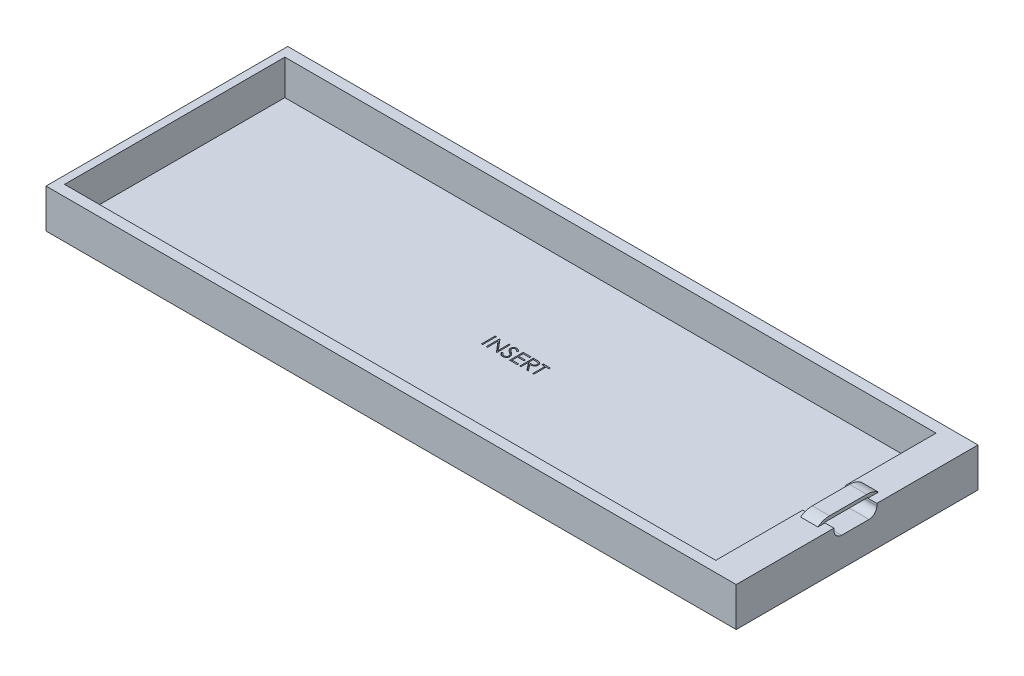
from build123d import *

# Parameters (mm, degrees)
SKETCH1_W           = 177
SKETCH1_H           = 62
BOSS_EXTRUDE1_DEPTH = 10
SKETCH2_W           = 167
SKETCH2_H           = 56.5
CUT_EXTRUDE2_DEPTH  = 9
SKETCH4_W           = 0.314102564
SKETCH4_H           = 3.5
CUT_EXTRUDE4_DEPTH  = 29
SKETCH5_W           = 4.425151698
SKETCH5_H           = 15.523308992
BOSS_EXTRUDE3_DEPTH = 1
SKETCH6_W           = 11
SKETCH6_H           = 2.75
CUT_EXTRUDE6_DEPTH  = 11
FILLET1_R           = 5
FILLET3_R           = 2


with BuildPart() as part:
    # Sketch1 → Boss-Extrude1 (new body)
    with BuildSketch(Plane(origin=(0, 0, 0), x_dir=(1, 0, 0), z_dir=(0, 1, 0))):
        Rectangle(SKETCH1_W, SKETCH1_H)
    extrude(amount=BOSS_EXTRUDE1_DEPTH)

    # Sketch2 → Cut-Extrude2 (cut)
    with BuildSketch(Plane(origin=(0, 10, 0), x_dir=(1, 0, 0), z_dir=(0, 1, 0))):
        with Locations((-3, 0)):
            Rectangle(SKETCH2_W, SKETCH2_H)
    extrude(amount=-CUT_EXTRUDE2_DEPTH, mode=Mode.SUBTRACT)

    # Sketch4 → Cut-Extrude4 (cut)
    # profile 1 of 6: a face of its own
    with BuildSketch(Plane(origin=(0, 1, 0), x_dir=(1, 0, 0), z_dir=(0, 1, 0))):
        with Locations((-6.451568608, 0.510197407)):
            Rectangle(SKETCH4_W, SKETCH4_H)
    # profile 2 of 6: a face of its own
    with BuildSketch(Plane(origin=(0, 1, 0), x_dir=(1, 0, 0), z_dir=(0, 1, 0))):
        Polygon((-5.397081429, -1.239802593), (-5.397081429, 2.260197407), (-5.33117598, 2.260197407), (-3.018876301, -0.494510125), (-3.018876301, 2.260197407), (-2.704773737, 2.260197407), (-2.704773737, -1.239802593), (-2.77628816, -1.239802593), (-5.082978865, 1.508594843), (-5.082978865, -1.239802593), align=None)
    # profile 3 of 6: a face of its own
    with BuildSketch(Plane(origin=(0, 1, 0), x_dir=(1, 0, 0), z_dir=(0, 1, 0))):
        with BuildLine():
            Line((-2.166312198, -0.564622305), (-1.870438801, -0.387238491))
            add(Edge.make_bspline(
                [(-1.870438801, -0.387238491), (-1.842920563, -0.433302876), (-1.790196683, -0.52156046), (-1.702245324, -0.6408185), (-1.611112412, -0.742180657), (-1.516123079, -0.825057264), (-1.417857131, -0.890306151), (-1.315673077, -0.936508383), (-1.209915266, -0.965324358), (-1.137941445, -0.968824445), (-1.102009313, -0.970571824)],
                knots=[0, 0, 0, 0, 1.272034388, 2.437168799, 3.508375237, 4.49857839, 5.41946034, 6.295179144, 7.148887113, 8, 8, 8, 8], degree=3))
            add(Edge.make_bspline(
                [(-1.102009313, -0.970571824), (-1.071322453, -0.969717152), (-1.01048568, -0.968022761), (-0.920923437, -0.951741959), (-0.833941635, -0.92672983), (-0.751332997, -0.890908899), (-0.674237382, -0.847570413), (-0.606630687, -0.795224236), (-0.548184574, -0.73661803), (-0.500375459, -0.671235375), (-0.463695424, -0.600918227), (-0.435503356, -0.528742275), (-0.419858282, -0.453573707), (-0.417501529, -0.402963244), (-0.416312198, -0.377422786)],
                knots=[0, 0, 0, 0, 1.095163259, 2.171163733, 3.241058638, 4.321873601, 5.38011039, 6.391990106, 7.366004449, 8.327778327, 9.272591725, 10.192022065, 11.087607919, 12, 12, 12, 12], degree=3))
            add(Edge.make_bspline(
                [(-0.416312198, -0.377422786), (-0.417786509, -0.348281936), (-0.420783567, -0.289042847), (-0.446115047, -0.201643194), (-0.485964294, -0.115150624), (-0.522726938, -0.061649358), (-0.541812999, -0.033873106)],
                knots=[0, 0, 0, 0, 0.938893495, 1.908633276, 2.914225137, 4, 4, 4, 4], degree=3))
            add(Edge.make_bspline(
                [(-0.541812999, -0.033873106), (-0.557483614, -0.013826283), (-0.590382108, 0.028259516), (-0.64693962, 0.090904751), (-0.713305735, 0.15552317), (-0.78720929, 0.224582227), (-0.871342379, 0.294870024), (-0.963069893, 0.369738302), (-1.064733752, 0.446339879), (-1.136033248, 0.497712445), (-1.172822615, 0.524219843)],
                knots=[0, 0, 0, 0, 0.722233717, 1.516239348, 2.393582979, 3.351407094, 4.387010283, 5.505090956, 6.712668013, 8, 8, 8, 8], degree=3))
            add(Edge.make_bspline(
                [(-1.172822615, 0.524219843), (-1.209646611, 0.55044843), (-1.280051288, 0.600595492), (-1.37850987, 0.675019776), (-1.466554333, 0.743063646), (-1.543793349, 0.805367658), (-1.610192946, 0.861940263), (-1.666276357, 0.912238202), (-1.710614914, 0.957621763), (-1.735270495, 0.987063105), (-1.746340243, 1.000281541)],
                knots=[0, 0, 0, 0, 1.452282411, 2.77665338, 3.964542531, 5.026858415, 5.96415736, 6.766646006, 7.446254459, 8, 8, 8, 8], degree=3))
            add(Edge.make_bspline(
                [(-1.746340243, 1.000281541), (-1.761812788, 1.020882578), (-1.792241625, 1.061397282), (-1.83240763, 1.12472214), (-1.866546793, 1.189545405), (-1.893309125, 1.25604127), (-1.915845344, 1.323276198), (-1.931003275, 1.392127444), (-1.940494672, 1.462286063), (-1.941466658, 1.509499563), (-1.941953224, 1.533134105)],
                knots=[0, 0, 0, 0, 1.068054152, 2.10047183, 3.106115577, 4.101338837, 5.06977816, 6.043150881, 7.020423561, 8, 8, 8, 8], degree=3))
            add(Edge.make_bspline(
                [(-1.941953224, 1.533134105), (-1.940648015, 1.57016388), (-1.938065495, 1.643431944), (-1.916224977, 1.750462774), (-1.881752084, 1.852649191), (-1.833457196, 1.948979525), (-1.771199843, 2.036945506), (-1.699153869, 2.117558993), (-1.613342382, 2.185327575), (-1.519189759, 2.244539634), (-1.416133387, 2.290885559), (-1.308142484, 2.325846539), (-1.195045412, 2.345655797), (-1.118442277, 2.348498561), (-1.079573416, 2.349940996)],
                knots=[0, 0, 0, 0, 1.005424448, 1.989358655, 2.955360095, 3.929531133, 4.905563448, 5.876582895, 6.856512386, 7.866279853, 8.892233794, 9.918561126, 10.94386622, 12, 12, 12, 12], degree=3))
            add(Edge.make_bspline(
                [(-1.079573416, 2.349940996), (-1.038329316, 2.348518445), (-0.956307964, 2.345689444), (-0.835658748, 2.321091912), (-0.719498032, 2.280391241), (-0.626054767, 2.234202583), (-0.552922006, 2.188071167), (-0.497149273, 2.146051343), (-0.440631822, 2.097676234), (-0.382913767, 2.042816988), (-0.324973108, 1.980970237), (-0.265949656, 1.912559548), (-0.205705387, 1.838002992), (-0.166949527, 1.784778491), (-0.147081429, 1.75749308)],
                knots=[0, 0, 0, 0, 1.286793592, 2.559021753, 3.825965368, 5.121522368, 5.803751409, 6.523245864, 7.299691795, 8.125521123, 9.008227632, 9.944561021, 10.946284179, 12, 12, 12, 12], degree=3))
            Line((-0.147081429, 1.75749308), (-0.431035756, 1.542248689))
            add(Edge.make_bspline(
                [(-0.431035756, 1.542248689), (-0.448181688, 1.564337379), (-0.481200745, 1.606875032), (-0.531330232, 1.666446348), (-0.57857888, 1.720862827), (-0.62512928, 1.768127956), (-0.668522911, 1.810830089), (-0.710639954, 1.847389846), (-0.750874305, 1.878165441), (-0.801591216, 1.911009001), (-0.865308934, 1.943565505), (-0.94529347, 1.971114583), (-1.028879745, 1.987669645), (-1.085809377, 1.989858532), (-1.114629506, 1.990966637)],
                knots=[0, 0, 0, 0, 1.181633172, 2.275549214, 3.290209073, 4.226197932, 5.078386478, 5.862611352, 6.581680152, 7.217281963, 8.414376989, 9.595101626, 10.782541182, 12, 12, 12, 12], degree=3))
            add(Edge.make_bspline(
                [(-1.114629506, 1.990966637), (-1.150786028, 1.989754937), (-1.220510476, 1.987418288), (-1.319500712, 1.961898303), (-1.408594637, 1.921716443), (-1.485147202, 1.865401465), (-1.548884179, 1.798680472), (-1.594989638, 1.721901617), (-1.622739802, 1.637119214), (-1.626126082, 1.577977558), (-1.62785066, 1.547857663)],
                knots=[0, 0, 0, 0, 1.14458467, 2.207223713, 3.21896685, 4.227309161, 5.202851033, 6.127160689, 7.046193047, 8, 8, 8, 8], degree=3))
            add(Edge.make_bspline(
                [(-1.62785066, 1.547857663), (-1.627457533, 1.529106185), (-1.626670637, 1.491572565), (-1.615695839, 1.436121143), (-1.60159651, 1.380809804), (-1.579253879, 1.325887221), (-1.548408575, 1.270392862), (-1.507903399, 1.213371124), (-1.456890087, 1.154319416), (-1.417813075, 1.115912042), (-1.397181589, 1.095634105)],
                knots=[0, 0, 0, 0, 0.858281714, 1.717966888, 2.583508476, 3.4729293, 4.427298488, 5.488583878, 6.674047936, 8, 8, 8, 8], degree=3))
            add(Edge.make_bspline(
                [(-1.397181589, 1.095634105), (-1.389520217, 1.08879708), (-1.37131855, 1.072553871), (-1.338042624, 1.045961591), (-1.294099826, 1.013158818), (-1.240637624, 0.972571502), (-1.176670263, 0.92549004), (-1.102190707, 0.872516428), (-1.018029174, 0.811930969), (-0.958307258, 0.769573428), (-0.926728865, 0.747176573)],
                knots=[0, 0, 0, 0, 0.420754252, 0.999615792, 1.744751191, 2.668019286, 3.750313428, 4.999500688, 6.413464383, 8, 8, 8, 8], degree=3))
            add(Edge.make_bspline(
                [(-0.926728865, 0.747176573), (-0.888742951, 0.719535214), (-0.815188495, 0.666011552), (-0.710530915, 0.585595872), (-0.615637107, 0.506948103), (-0.530173904, 0.430570496), (-0.453296995, 0.357042403), (-0.385859274, 0.285479223), (-0.327173594, 0.21639365), (-0.263994376, 0.127821075), (-0.199436556, 0.01903999), (-0.143995049, -0.114238248), (-0.109036701, -0.248034569), (-0.104465186, -0.337961405), (-0.102209634, -0.382330638)],
                knots=[0, 0, 0, 0, 1.163667725, 2.253281268, 3.268753668, 4.215851969, 5.092017293, 5.902905408, 6.650798638, 7.335211899, 8.59617414, 9.77448103, 10.901945474, 12, 12, 12, 12], degree=3))
            add(Edge.make_bspline(
                [(-0.102209634, -0.382330638), (-0.102866772, -0.413709003), (-0.104168287, -0.475856387), (-0.119129201, -0.567111464), (-0.141048866, -0.655742333), (-0.1740861, -0.740653446), (-0.214409258, -0.823398209), (-0.265575506, -0.901806109), (-0.324883191, -0.977612508), (-0.392916956, -1.048795999), (-0.467362858, -1.114142195), (-0.546046553, -1.172271256), (-0.629096826, -1.22073958), (-0.716063142, -1.260290422), (-0.806965479, -1.291223939), (-0.901773263, -1.313636808), (-1.000642774, -1.327392519), (-1.067843256, -1.328820281), (-1.102009313, -1.329546183)],
                knots=[0, 0, 0, 0, 0.983748083, 1.948392443, 2.894712957, 3.844097841, 4.80183111, 5.778335162, 6.776009319, 7.81870978, 8.863265674, 9.881300176, 10.883814829, 11.87499822, 12.874611388, 13.892143829, 14.928324115, 16, 16, 16, 16], degree=3))
            add(Edge.make_bspline(
                [(-1.102009313, -1.329546183), (-1.128444656, -1.329035002), (-1.180982417, -1.328019076), (-1.258691898, -1.319037796), (-1.334831488, -1.306330692), (-1.40844577, -1.286156622), (-1.480483181, -1.261679645), (-1.550630416, -1.231541312), (-1.61892147, -1.195424111), (-1.685739053, -1.154129086), (-1.750913227, -1.106071342), (-1.813832695, -1.050097845), (-1.876561881, -0.98775234), (-1.937249277, -0.917341777), (-1.997122421, -0.840003694), (-2.055000831, -0.755014511), (-2.112082548, -0.662837157), (-2.147898016, -0.597972071), (-2.166312198, -0.564622305)],
                knots=[0, 0, 0, 0, 0.915332311, 1.819136955, 2.706846663, 3.586547465, 4.459518054, 5.340707479, 6.227863349, 7.133153174, 8.059268498, 9.028702269, 10.047606654, 11.120612155, 12.245963614, 13.433783089, 14.680604001, 16, 16, 16, 16], degree=3))
        make_face()
    # profile 4 of 6: a face of its own
    with BuildSketch(Plane(origin=(0, 1, 0), x_dir=(1, 0, 0), z_dir=(0, 1, 0))):
        Polygon((0.615739084, 2.260197407), (2.590098058, 2.260197407), (2.590098058, 1.901223048), (0.929841648, 1.901223048), (0.929841648, 0.824299971), (2.590098058, 0.824299971), (2.590098058, 0.465325612), (0.929841648, 0.465325612), (0.929841648, -0.880828234), (2.590098058, -0.880828234), (2.590098058, -1.239802593), (0.615739084, -1.239802593), align=None)
    # profile 5 of 6: a face of its own
    with BuildSketch(Plane(origin=(0, 1, 0), x_dir=(1, 0, 0), z_dir=(0, 1, 0))):
        with BuildLine():
            Line((3.218303187, 2.260197407), (3.91872386, 2.260197407))
            add(Edge.make_bspline(
                [(3.91872386, 2.260197407), (3.965464988, 2.260041821), (4.055213133, 2.259743078), (4.183786403, 2.258077315), (4.3006135, 2.25330296), (4.405633339, 2.249194376), (4.498843994, 2.241702435), (4.580531285, 2.234541788), (4.650318982, 2.225168127), (4.692564834, 2.216462704), (4.71169261, 2.212521125)],
                knots=[0, 0, 0, 0, 1.410062039, 2.707475311, 3.878576406, 4.937260626, 5.877586885, 6.699081471, 7.410979367, 8, 8, 8, 8], degree=3))
            add(Edge.make_bspline(
                [(4.71169261, 2.212521125), (4.737299234, 2.206194359), (4.787966223, 2.193675796), (4.860916289, 2.167216195), (4.930430613, 2.13659657), (4.996220438, 2.10063285), (5.057956229, 2.05905807), (5.116274539, 2.012589948), (5.171440003, 1.961482742), (5.221221633, 1.9044479), (5.268160685, 1.844611391), (5.307749311, 1.779907634), (5.341875791, 1.712246106), (5.369046308, 1.640938689), (5.390924281, 1.566676917), (5.406350521, 1.48878812), (5.415601708, 1.407627145), (5.416543564, 1.352269236), (5.417021135, 1.32419981)],
                knots=[0, 0, 0, 0, 1.027469482, 2.033020251, 3.019912614, 3.986113645, 4.951240523, 5.91722682, 6.890402269, 7.87763091, 8.8651537, 9.85103654, 10.82876324, 11.815024772, 12.821070561, 13.842952187, 14.906261191, 16, 16, 16, 16], degree=3))
            add(Edge.make_bspline(
                [(5.417021135, 1.32419981), (5.415552137, 1.277564706), (5.412685741, 1.186567538), (5.385960638, 1.054506657), (5.342184118, 0.931317342), (5.281860829, 0.817154704), (5.205041353, 0.714244059), (5.112716562, 0.623853603), (5.004834951, 0.548213691), (4.904405635, 0.495760886), (4.815691435, 0.462167977), (4.742658122, 0.438531619), (4.662991145, 0.420269653), (4.57745381, 0.403909522), (4.485690155, 0.391557827), (4.387920115, 0.382511233), (4.284073964, 0.376857184), (4.212734894, 0.376015179), (4.176035558, 0.375582022)],
                knots=[0, 0, 0, 0, 1.260483769, 2.459530307, 3.627416485, 4.787058657, 5.939039949, 7.08810263, 8.267026773, 9.491475466, 10.141966685, 10.831826277, 11.566392101, 12.351337768, 13.187381173, 14.07005841, 15.007169909, 16, 16, 16, 16], degree=3))
            Line((4.176035558, 0.375582022), (5.46189293, -1.239802593))
            Line((5.46189293, -1.239802593), (5.073471456, -1.239802593))
            Line((5.073471456, -1.239802593), (3.787614084, 0.375582022))
            Line((3.787614084, 0.375582022), (3.532405751, 0.375582022))
            Line((3.532405751, 0.375582022), (3.532405751, -1.239802593))
            Line((3.532405751, -1.239802593), (3.218303187, -1.239802593))
            Line((3.218303187, -1.239802593), (3.218303187, 2.260197407))
        make_face()
        with BuildLine():
            Line((3.532405751, 1.901223048), (3.532405751, 0.734556381))
            Line((3.532405751, 0.734556381), (4.173231071, 0.729648528))
            add(Edge.make_bspline(
                [(4.173231071, 0.729648528), (4.20315111, 0.729635292), (4.261144667, 0.729609635), (4.345045332, 0.733603412), (4.423165444, 0.73814673), (4.495206196, 0.745096075), (4.561199771, 0.754052147), (4.621113184, 0.765255131), (4.675044236, 0.778307194), (4.737942775, 0.79850882), (4.808179306, 0.830514838), (4.884510766, 0.877080337), (4.949513104, 0.935649456), (5.004430966, 1.002622912), (5.048560397, 1.076259161), (5.079672452, 1.15567553), (5.099414894, 1.238867128), (5.10174344, 1.296045236), (5.102918571, 1.324900932)],
                knots=[0, 0, 0, 0, 1.146690395, 2.22261258, 3.21895312, 4.145990853, 4.996080663, 5.770904154, 6.481378293, 7.121626537, 8.300444488, 9.431385265, 10.535395872, 11.636531494, 12.74115979, 13.810798291, 14.895190096, 16, 16, 16, 16], degree=3))
            add(Edge.make_bspline(
                [(5.102918571, 1.324900932), (5.10171645, 1.353047506), (5.099334285, 1.408823745), (5.079885516, 1.490479655), (5.046996135, 1.567546605), (5.002673897, 1.63971109), (4.948674742, 1.705216826), (4.885356929, 1.761263979), (4.814451734, 1.807513444), (4.748180536, 1.837067824), (4.688946323, 1.855187677), (4.637516663, 1.867938841), (4.579405185, 1.87818331), (4.514329727, 1.886391371), (4.442568096, 1.893446315), (4.363757445, 1.898198094), (4.278420665, 1.901011958), (4.219273734, 1.901151047), (4.188655751, 1.901223048)],
                knots=[0, 0, 0, 0, 1.101028733, 2.181837193, 3.264309656, 4.369019818, 5.486613113, 6.575447106, 7.666700264, 8.788928104, 9.402425223, 10.0903467, 10.862060571, 11.710948788, 12.657782767, 13.684531032, 14.801375019, 16, 16, 16, 16], degree=3))
            Line((4.188655751, 1.901223048), (3.532405751, 1.901223048))
        make_face(mode=Mode.SUBTRACT)
    # profile 6 of 6: a face of its own
    with BuildSketch(Plane(origin=(0, 1, 0), x_dir=(1, 0, 0), z_dir=(0, 1, 0))):
        Polygon((5.775995494, 1.901223048), (5.775995494, 2.260197407), (7.615739084, 2.260197407), (7.615739084, 1.901223048), (6.852918571, 1.901223048), (6.852918571, -1.239802593), (6.538816007, -1.239802593), (6.538816007, 1.901223048), align=None)
    extrude(amount=-CUT_EXTRUDE4_DEPTH, mode=Mode.SUBTRACT)


with BuildPart() as cut_extrude4_piece_1:
    # of the separate pieces the step leaves, piece 1, a body of its own (cut_extrude4_pieces)
    add(part.part.solids().sort_by_distance((88.5, 0, -31))[0])

    # Sketch5 → Boss-Extrude3 (add)
    with BuildSketch(Plane(origin=(0, 10, 0), x_dir=(1, 0, 0), z_dir=(0, 1, 0))):
        with Locations((83.9869886, 0)):
            Rectangle(SKETCH5_W, SKETCH5_H)
    extrude(amount=BOSS_EXTRUDE3_DEPTH)

    # Sketch6 → Cut-Extrude6 (cut)
    with BuildSketch(Plane(origin=(88.5, 0, 0), x_dir=(0, 0, -1), z_dir=(1, 0, 0))):
        with Locations((-0.446310917, 8.805214365)):
            Rectangle(SKETCH6_W, SKETCH6_H)
    extrude(amount=-CUT_EXTRUDE6_DEPTH, mode=Mode.SUBTRACT)

    # Fillet1
    # the kernel refuses this fillet: 5 mm, written as the material it takes off along each edge
    with BuildSketch(Plane(origin=(74.274412751, 11, -7.761654496), x_dir=(0, -1, 0), z_dir=(1, 0, 0)), Plane(origin=(93.699564449, 11, 7.761654496), x_dir=(0, -1, 0), z_dir=(-1, 0, 0))) as fillet1_piece_1:
        with BuildLine():
            CenterArc((5, -3), FILLET1_R, 143.130102354, 36.869897646)
            Line((0, -3), (-0.1, -3))
            Line((-0.1, -3), (-0.1, 0))
            Line((-0.1, 0), (0, 0.1))
            ThreePointArc((0, 0.1), (0.5, 0.1), (0.92, 0.06))
            Line((0.92, 0.06), (1, 0))
        make_face()
    extrude(amount=19.425151699, mode=Mode.SUBTRACT)

    # Fillet3
    fillet3_edges = [cut_extrude4_piece_1.edges().sort_by_distance(p)[0] for p in [
        (84.5, 7.430214365, -5.053689083),
        (84.5, 7.430214365, 5.946310917),
    ]]
    fillet(fillet3_edges, radius=FILLET3_R)


with BuildPart() as cut_extrude4_piece_2:
    # of the separate pieces the step leaves, piece 2, a body of its own (cut_extrude4_pieces)
    add(part.part.solids().sort_by_distance((4.188655751, 0, -1.901223048))[0])


solid = Compound([cut_extrude4_piece_1.part, cut_extrude4_piece_2.part])
